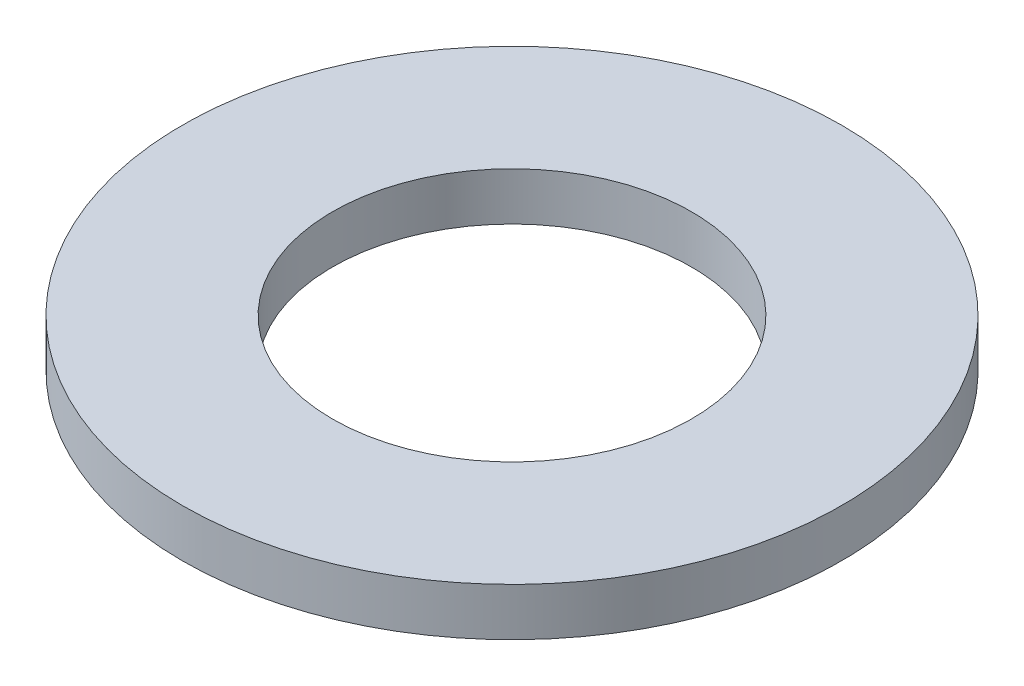
from build123d import *

# Parameters (mm, degrees)
SKETCH1_R           = 5.9436
BOSS_EXTRUDE1_DEPTH = 0.8636
SKETCH5_R           = 3.2385
CUT_EXTRUDE1_DEPTH  = 9.449767268


with BuildPart() as part:
    # Sketch1 → Boss-Extrude1 (new body)
    with BuildSketch(Plane(origin=(0, 0, 0), x_dir=(1, 0, 0), z_dir=(0, 1, 0))):
        Circle(SKETCH1_R)
    extrude(amount=BOSS_EXTRUDE1_DEPTH)

    # Sketch5 → Cut-Extrude1 (cut, through all)
    with BuildSketch(Plane(origin=(0, 0.8636, 0), x_dir=(-1, 0, 0), z_dir=(0, 1, 0))):
        Circle(SKETCH5_R)
    extrude(amount=-CUT_EXTRUDE1_DEPTH, mode=Mode.SUBTRACT)


solid = part.part
